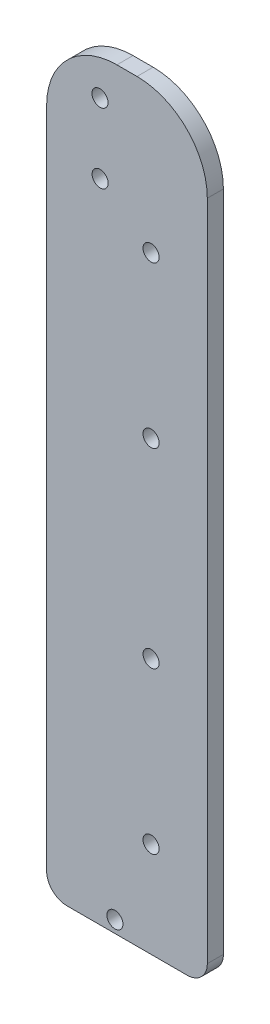
from build123d import *

# Parameters (mm, degrees)
SKETCH1_R           = 2.032
BOSS_EXTRUDE2_DEPTH = 4.064


with BuildPart() as part:
    # Sketch1 → Boss-Extrude2 (new body)
    with BuildSketch(Plane.XY):
        with BuildLine():
            Line((40.64, 5.08), (40.64, 172.72))
            ThreePointArc((40.64, 172.72), (35.432358569, 185.292358569), (22.86, 190.5))
            Line((22.86, 190.5), (17.78, 190.5))
            ThreePointArc((17.78, 190.5), (5.207641431, 185.292358569), (0, 172.72))
            Line((0, 172.72), (0, 5.08))
            ThreePointArc((0, 5.08), (1.487897552, 1.487897552), (5.08, 0))
            Line((5.08, 0), (26.416, 0))
            Line((26.416, 0), (35.56, 0))
            ThreePointArc((35.56, 0), (39.152102448, 1.487897552), (40.64, 5.08))
        make_face()
        with Locations((26.416, 24.13)):
            Circle(SKETCH1_R, mode=Mode.SUBTRACT)
        with Locations((26.416, 64.77)):
            Circle(SKETCH1_R, mode=Mode.SUBTRACT)
        with Locations((26.416, 113.03)):
            Circle(SKETCH1_R, mode=Mode.SUBTRACT)
        with Locations((26.416, 153.67)):
            Circle(SKETCH1_R, mode=Mode.SUBTRACT)
        with Locations((17.272, 3.048)):
            Circle(SKETCH1_R, mode=Mode.SUBTRACT)
        with Locations((13.492529792, 181.102)):
            Circle(SKETCH1_R, mode=Mode.SUBTRACT)
        with Locations((13.531045562, 163.449)):
            Circle(SKETCH1_R, mode=Mode.SUBTRACT)
    extrude(amount=BOSS_EXTRUDE2_DEPTH)


solid = part.part
